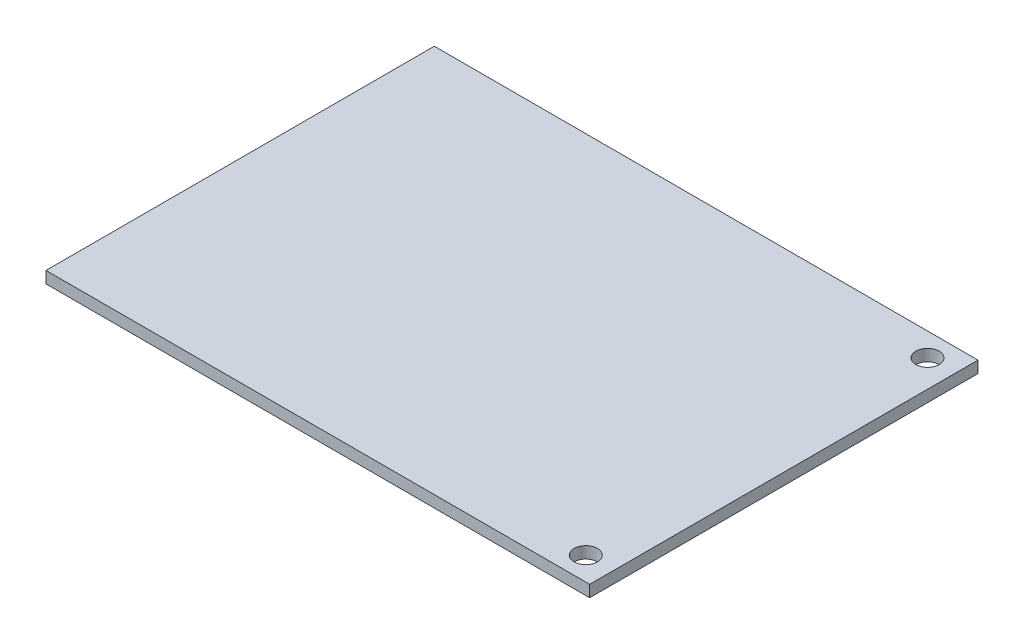
from build123d import *

# Parameters (mm, degrees)
SKETCH1_W           = 70
SKETCH1_H           = 50
SKETCH1_R           = 1.5
BOSS_EXTRUDE1_DEPTH = 1.5


with BuildPart() as part:
    # Sketch1 → Boss-Extrude1 (new body)
    with BuildSketch(Plane(origin=(0, 0, 0), x_dir=(1, 0, 0), z_dir=(0, 1, 0))):
        with Locations((35, 25)):
            Rectangle(SKETCH1_W, SKETCH1_H)
        with Locations((66.5, 47)):
            Circle(SKETCH1_R, mode=Mode.SUBTRACT)
        with Locations((66.5, 3)):
            Circle(SKETCH1_R, mode=Mode.SUBTRACT)
    extrude(amount=BOSS_EXTRUDE1_DEPTH)


solid = part.part
